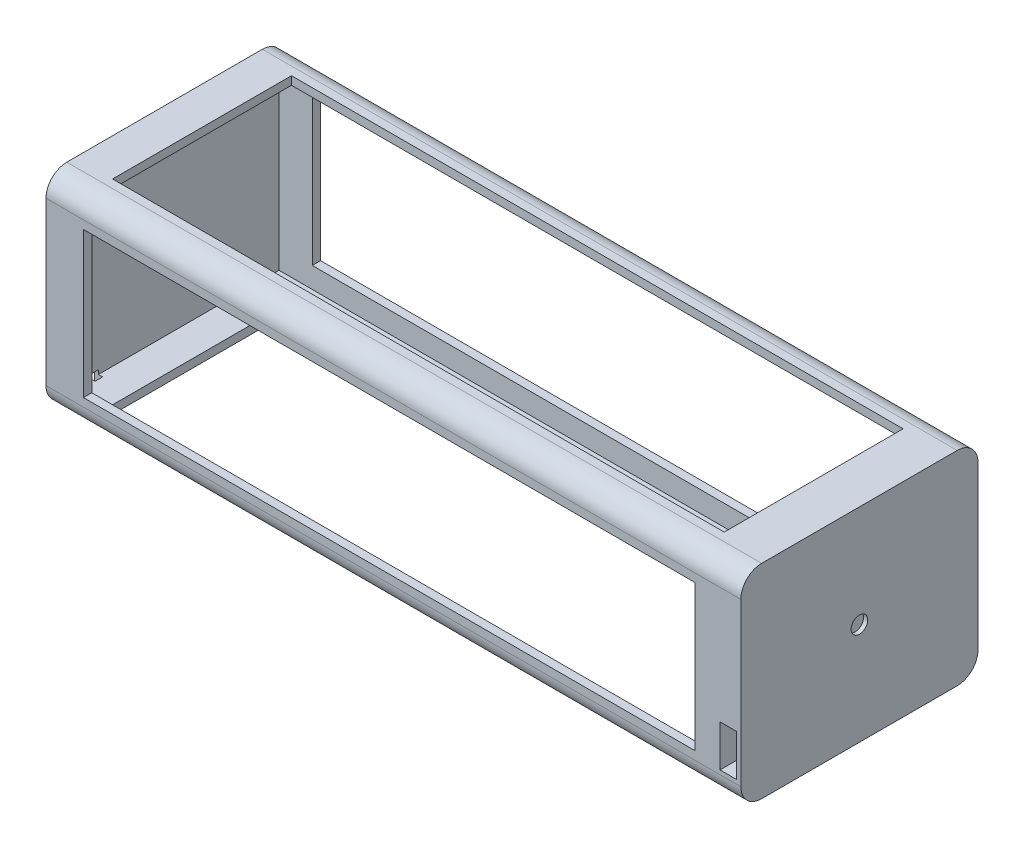
from build123d import *

# Parameters (mm, degrees)
SKETCH_1_W          = 57
SKETCH_1_H          = 49
SKETCH_1_W_2        = 53
SKETCH_1_H_2        = 45
EXTRUDE_1_DEPTH     = 5
EXTRUDE_2_DEPTH     = 147
SKETCH_3_W          = 57
SKETCH_3_H          = 49
SKETCH_3_W_2        = 53
SKETCH_3_H_2        = 45
EXTRUDE_3_DEPTH     = 8
SKETCH_5_W          = 57
SKETCH_5_H          = 49
EXTRUDE_4_DEPTH     = 1
SKETCH_7_W          = 57
SKETCH_7_H          = 49
EXTRUDE_6_DEPTH     = 1
SKETCH_8_W          = 1.8
SKETCH_8_H          = 3
SKETCH_8_W_2        = 0.5
SKETCH_8_H_2        = 1.5
CUT_EXTRUDE_1_DEPTH = 2
SKETCH_9_W          = 2.6
SKETCH_9_H          = 10
EXTRUDE_7_DEPTH     = 4
SKETCH_10_W         = 57
SKETCH_10_H         = 49
EXTRUDE_8_DEPTH     = 1
SKETCH_11_R         = 2
CUT_EXTRUDE_2_DEPTH = 6
FILLET_2_R          = 5


with BuildPart() as part:
    # Эскиз1 → Бобышка-Вытянуть1 (new body)
    with BuildSketch(Plane(origin=(0, 0, 0), x_dir=(0, 0, -1), z_dir=(1, 0, 0))):
        Rectangle(SKETCH_1_W, SKETCH_1_H)
        Rectangle(SKETCH_1_W_2, SKETCH_1_H_2, mode=Mode.SUBTRACT)
    extrude(amount=-EXTRUDE_1_DEPTH)

    # Эскиз2 → Бобышка-Вытянуть2 (add)
    with BuildSketch(Plane(origin=(-5, 0, 0), x_dir=(0, 0, -1), z_dir=(1, 0, 0))):
        Polygon((28.5, 17.5), (28.5, 24.5), (21.5, 24.5), (21.5, 22.5), (26.5, 22.5), (26.5, 17.5), align=None)
        Polygon((-21.5, 24.5), (-28.5, 24.5), (-28.5, 17.5), (-26.5, 17.5), (-26.5, 22.5), (-21.5, 22.5), align=None)
        Polygon((-28.5, -17.5), (-28.5, -24.5), (-21.5, -24.5), (-21.5, -22.5), (-26.5, -22.5), (-26.5, -17.5), align=None)
        Polygon((21.5, -24.5), (28.5, -24.5), (28.5, -17.5), (26.5, -17.5), (26.5, -22.5), (21.5, -22.5), align=None)
    extrude(amount=-EXTRUDE_2_DEPTH)

    # Эскиз3 → Бобышка-Вытянуть3 (add)
    with BuildSketch(Plane(origin=(-152, 0, 0), x_dir=(0, 0, -1), z_dir=(1, 0, 0))):
        Rectangle(SKETCH_3_W, SKETCH_3_H)
        Rectangle(SKETCH_3_W_2, SKETCH_3_H_2, mode=Mode.SUBTRACT)
    extrude(amount=-EXTRUDE_3_DEPTH)

    # Эскиз5 → Бобышка-Вытянуть4 (add)
    with BuildSketch(Plane(origin=(0, 0, 0), x_dir=(0, 0, -1), z_dir=(1, 0, 0))):
        Rectangle(SKETCH_5_W, SKETCH_5_H)
    extrude(amount=EXTRUDE_4_DEPTH)

    # Эскиз7 → Бобышка-Вытянуть6 (add)
    with BuildSketch(Plane.ZY.offset(160)):
        Rectangle(SKETCH_7_W, SKETCH_7_H)
    extrude(amount=EXTRUDE_6_DEPTH)

    # Эскиз8 → Вырез-Вытянуть1 (cut)
    with BuildSketch(Plane.ZY.offset(161)):
        with Locations((21.6, -23)):
            Rectangle(SKETCH_8_W, SKETCH_8_H)
        with Locations((17.8, -23)):
            Rectangle(SKETCH_8_W, SKETCH_8_H)
        with Locations((14.65, -23.75)):
            Rectangle(SKETCH_8_W_2, SKETCH_8_H_2)
        with Locations((13.15, -23.75)):
            Rectangle(SKETCH_8_W_2, SKETCH_8_H_2)
        with Locations((11.65, -23.75)):
            Rectangle(SKETCH_8_W_2, SKETCH_8_H_2)
        with Locations((10.15, -23.75)):
            Rectangle(SKETCH_8_W_2, SKETCH_8_H_2)
        with Locations((8.65, -23.75)):
            Rectangle(SKETCH_8_W_2, SKETCH_8_H_2)
        with Locations((7.15, -23.75)):
            Rectangle(SKETCH_8_W_2, SKETCH_8_H_2)
        with Locations((5.65, -23.75)):
            Rectangle(SKETCH_8_W_2, SKETCH_8_H_2)
    extrude(amount=-CUT_EXTRUDE_1_DEPTH, mode=Mode.SUBTRACT)

    # Эскиз9 → Бобышка-Вытянуть7 (add)
    with BuildSketch(Plane(origin=(1, 0, 0), x_dir=(0, 0, -1), z_dir=(1, 0, 0))):
        Polygon((24.5, -20.5), (-24.5, -20.5), (-24.5, -18.5), (-28.5, -18.5), (-28.5, -24.5), (28.5, -24.5), (28.5, 8.5), (24.5, 8.5), align=None)
        Polygon((24.5, 20.5), (-24.5, 20.5), (-24.5, -8.5), (-28.5, -8.5), (-28.5, 24.5), (28.5, 24.5), (28.5, 18.5), (24.5, 18.5), align=None)
        with Locations((0, -13.5)):
            Rectangle(SKETCH_9_W, SKETCH_9_H)
        with Locations((0, 13.5)):
            Rectangle(SKETCH_9_W, SKETCH_9_H)
    extrude(amount=EXTRUDE_7_DEPTH)

    # Эскиз10 → Бобышка-Вытянуть8 (add)
    with BuildSketch(Plane(origin=(5, 0, 0), x_dir=(0, 0, -1), z_dir=(1, 0, 0))):
        Rectangle(SKETCH_10_W, SKETCH_10_H)
    extrude(amount=EXTRUDE_8_DEPTH)

    # Эскиз11 → Вырез-Вытянуть2 (cut)
    with BuildSketch(Plane(origin=(6, 0, 0), x_dir=(0, 0, -1), z_dir=(1, 0, 0))):
        Circle(SKETCH_11_R)
    extrude(amount=-CUT_EXTRUDE_2_DEPTH, mode=Mode.SUBTRACT)

    # Скругление2
    fillet_2_edges = [part.edges().sort_by_distance(p)[0] for p in [
        (-77.5, -24.5, 28.5),
        (-77.5, -24.5, -28.5),
        (-77.5, 24.5, -28.5),
        (-77.5, 24.5, 28.5),
    ]]
    fillet(fillet_2_edges, radius=FILLET_2_R)


solid = part.part
